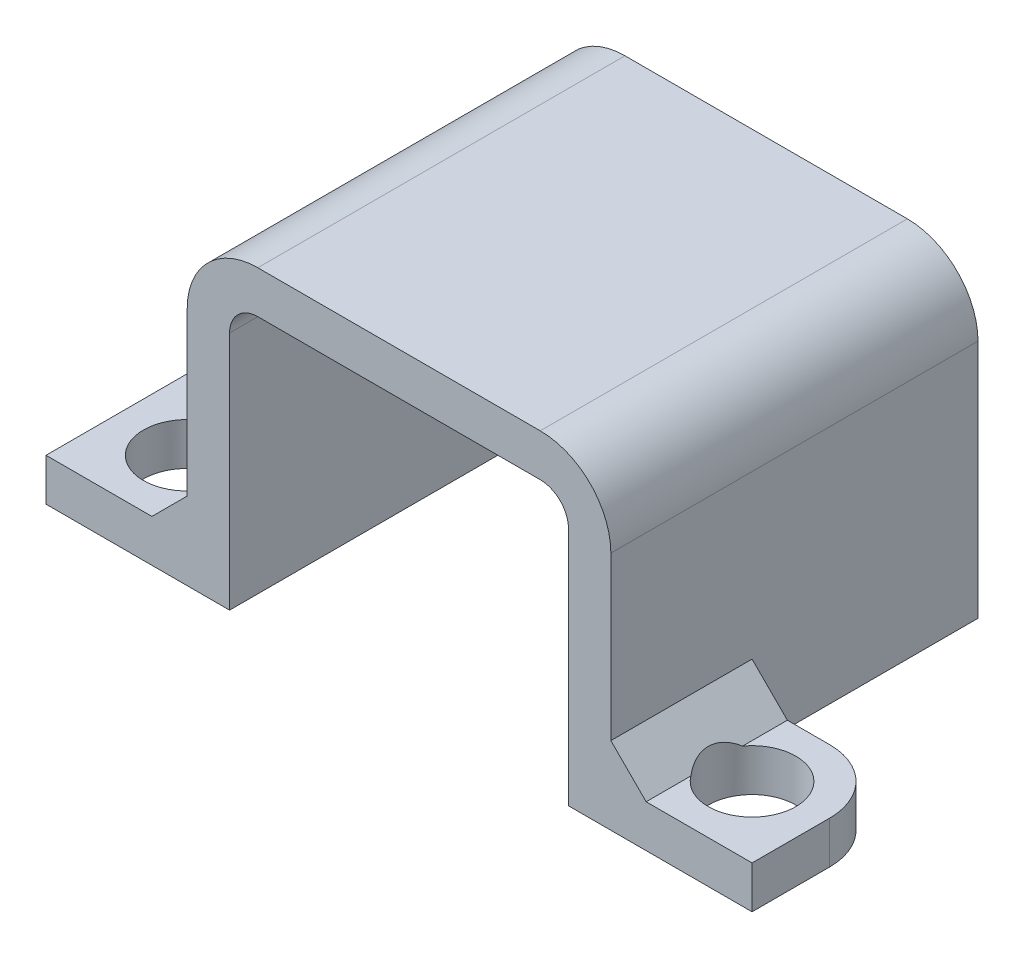
from build123d import *
from build123d.topology import SkipClean

# Parameters (mm, degrees)
BOSS_EXTRUDE1_DEPTH = 13
SKETCH2_W           = 5
SKETCH2_H           = 8
CUT_EXTRUDE1_DEPTH  = 21.383817111
SKETCH3_R           = 1.55
CUT_EXTRUDE2_DEPTH  = 21.383817111
FILLET1_R           = 1
FILLET2_R           = 2.5
CHAMFER1_SIZE       = 4
FILLET3_R           = 2.25
FILLET4_R           = 2.25
CHAMFER2_START      = -13
CHAMFER2_DEPTH      = 13
CHAMFER2_START_2    = -5
CHAMFER2_2_DEPTH    = 5
CHAMFER2_START_3    = -8
CHAMFER2_3_DEPTH    = 1.181980515


with BuildPart() as part:
    # Sketch1 → Boss-Extrude1 (new body)
    with BuildSketch(Plane.XY):
        Polygon((6, 0), (-6, 0), (-6, -9.5), (-12.5, -9.5), (-12.5, -8), (-7.5, -8), (-7.5, 1.5), (7.5, 1.5), (7.5, -8), (12.5, -8), (12.5, -9.5), (6, -9.5), align=None)
    extrude(amount=-BOSS_EXTRUDE1_DEPTH)

    # Sketch2 → Cut-Extrude1 (cut, through all)
    with BuildSketch(Plane(origin=(0, -8, 0), x_dir=(1, 0, 0), z_dir=(0, 1, 0))):
        with Locations((10, 9)):
            Rectangle(SKETCH2_W, SKETCH2_H)
    extrude(amount=-CUT_EXTRUDE1_DEPTH, mode=Mode.SUBTRACT)

    # Sketch3 → Cut-Extrude2 (cut, through all)
    with BuildSketch(Plane(origin=(0, -8, 0), x_dir=(1, 0, 0), z_dir=(0, 1, 0))):
        with Locations(Location((10, 2.5, 0), (0, 0, 180))):
            Circle(SKETCH3_R)
        with Locations(Location((-10, 2.5, 0), (0, 0, 180))):
            Circle(SKETCH3_R)
    extrude(amount=-CUT_EXTRUDE2_DEPTH, mode=Mode.SUBTRACT)

    # Fillet1
    fillet1_edges = [part.edges().sort_by_distance(p)[0] for p in [
        (6, 0, -6.5),
        (-6, 0, -6.5),
    ]]
    fillet(fillet1_edges, radius=FILLET1_R)

    # Fillet2
    fillet2_edges = [part.edges().sort_by_distance(p)[0] for p in [
        (-7.5, 1.5, -6.5),
        (7.5, 1.5, -6.5),
    ]]
    fillet(fillet2_edges, radius=FILLET2_R)

    # Chamfer1
    chamfer1_edges = [part.edges().sort_by_distance(p)[0] for p in [
        (-12.5, -8.75, -13),
    ]]
    chamfer(chamfer1_edges, length=CHAMFER1_SIZE)

    # Fillet3
    fillet3_edges = [part.edges().sort_by_distance(p)[0] for p in [
        (-12.5, -8.75, -9),
        (-8.5, -8.75, -13),
    ]]
    fillet(fillet3_edges, radius=FILLET3_R)

    # Fillet4
    fillet4_edges = [part.edges().sort_by_distance(p)[0] for p in [
        (12.5, -8.75, -5),
    ]]
    fillet(fillet4_edges, radius=FILLET4_R)

    # Chamfer2: read off the stored shape, not the designer's step
    # Chamfer2 outline → Chamfer2 (add)
    with BuildSketch(Plane.XY.offset(CHAMFER2_START)):
        Polygon((-7.5, -8), (-7.5, -6.75), (-8.75, -8), align=None)
    extrude(amount=CHAMFER2_DEPTH)

    # Chamfer2 2 outline → Chamfer2 2 (add)
    with BuildSketch(Plane.XY.offset(CHAMFER2_START_2)):
        Polygon((7.5, -8), (8.75, -8), (7.5, -6.75), align=None)
    extrude(amount=CHAMFER2_2_DEPTH)

    # Chamfer2 3 outline → Chamfer2 3 (cut)
    with SkipClean():  # the faces are left unmerged after this step: merging them gives an invalid solid
        with BuildSketch(Plane(origin=(0, 0, 0), x_dir=(1, 0, 0), z_dir=(0, 1, 0)).offset(CHAMFER2_START_3)):
            with BuildLine():
                Line((8.75, 1.583484861), (8.75, 3.416515139))
                ThreePointArc((8.75, 3.416515139), (8.45, 2.5), (8.75, 1.583484861))
            make_face()
            with BuildLine():
                Line((-7.568019485, 13), (-8.75, 13))
                Line((-8.75, 13), (-8.75, 12.664529201))
                ThreePointArc((-8.75, 12.664529201), (-8.182352171, 12.914508108), (-7.568019485, 13))
            make_face()
            with BuildLine():
                ThreePointArc((-8.75, 1.583484861), (-8.45, 2.5), (-8.75, 3.416515139))
                Line((-8.75, 3.416515139), (-8.75, 1.583484861))
            make_face()
        extrude(amount=CHAMFER2_3_DEPTH, mode=Mode.SUBTRACT)


solid = part.part
